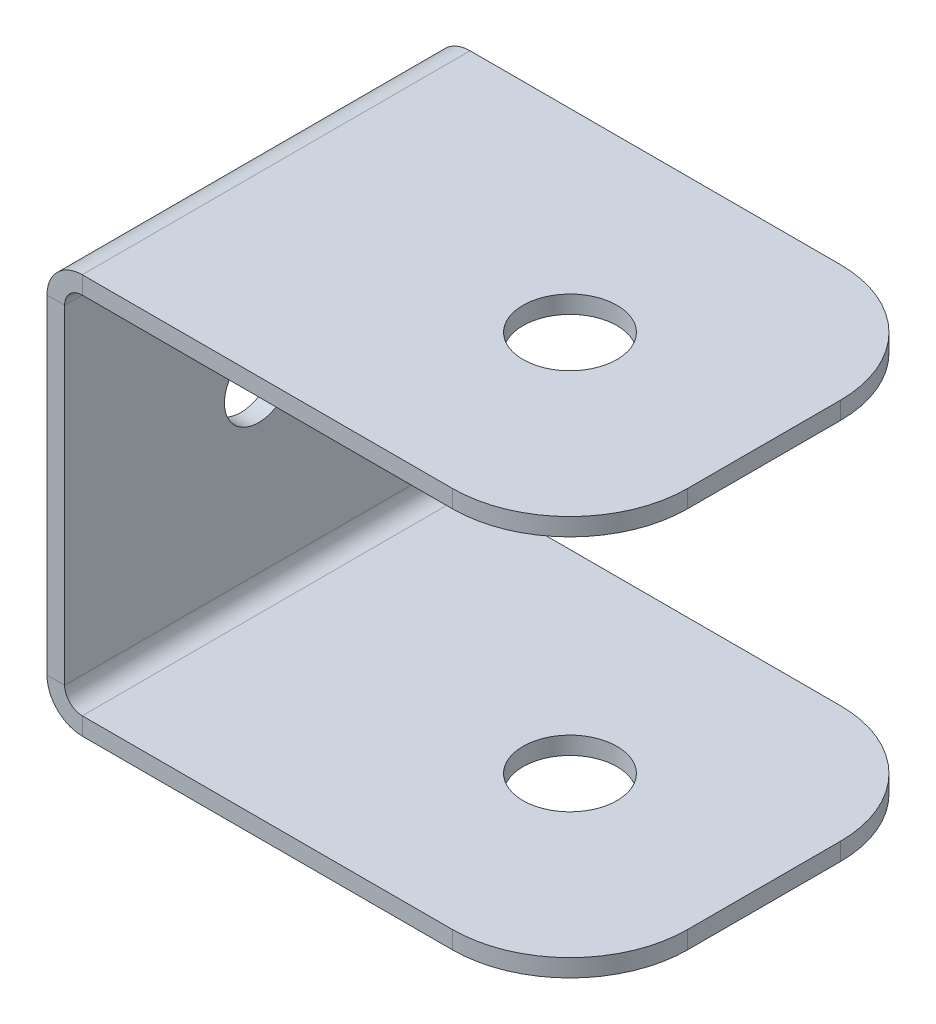
from build123d import *

# Parameters (mm, degrees)
BASE_FLANGE1_DEPTH   = 16.5
SKETCH6_R            = 4
CUT_EXTRUDE1_DEPTH   = 58.247270677
M5_CLEARANCE_HOLE1_D = 5.8
FILLET1_R            = 10


# Sheet-metal steps are written as plain solids
with BuildPart() as part:
    # Sketch1 → Base-Flange1 (new, symmetric)
    with BuildSketch(Plane.XY):
        with BuildLine():
            Line((43, 15.5), (1.5, 15.5))
            ThreePointArc((1.5, 15.5), (0.439339828, 15.060660172), (0, 14))
            Line((0, 14), (0, -14))
            ThreePointArc((0, -14), (0.439339828, -15.060660172), (1.5, -15.5))
            Line((1.5, -15.5), (43, -15.5))
            Line((43, -15.5), (43, -17))
            Line((43, -17), (1.5, -17))
            ThreePointArc((1.5, -17), (-0.621320344, -16.121320344), (-1.5, -14))
            Line((-1.5, -14), (-1.5, 14))
            ThreePointArc((-1.5, 14), (-0.621320344, 16.121320344), (1.5, 17))
            Line((1.5, 17), (43, 17))
            Line((43, 17), (43, 15.5))
        make_face()
    extrude(amount=BASE_FLANGE1_DEPTH, both=True)

    # Sketch6 → Cut-Extrude1 (cut, through all)
    with BuildSketch(Plane(origin=(0, 17, 0), x_dir=(1, 0, 0), z_dir=(0, 1, 0))):
        with Locations(Location((26.5, 0, 0), (0, 0, 270))):
            Circle(SKETCH6_R)
    extrude(amount=-CUT_EXTRUDE1_DEPTH, mode=Mode.SUBTRACT)

    # M5 Clearance Hole1 (through all)
    with Locations(Plane.ZY.offset(1.5)):
        with Locations((0, 0)):
            Hole(M5_CLEARANCE_HOLE1_D / 2)

    # Fillet1
    fillet1_edges = [part.edges().sort_by_distance(p)[0] for p in [
        (43, 16.25, -16.5),
        (43, -16.25, -16.5),
        (43, 16.25, 16.5),
        (43, -16.25, 16.5),
    ]]
    fillet(fillet1_edges, radius=FILLET1_R)


solid = part.part
